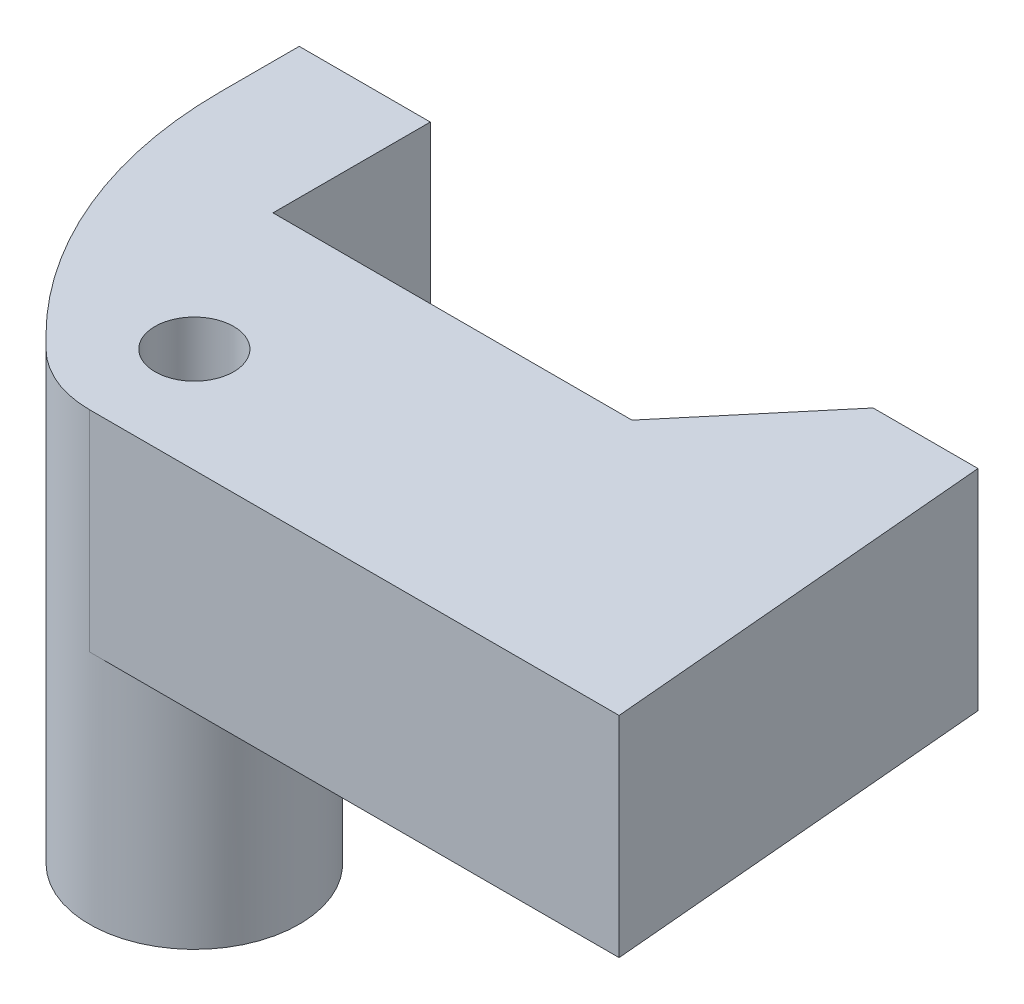
from build123d import *

# Parameters (mm, degrees)
SKETCH1_R           = 1.5
BOSS_EXTRUDE1_DEPTH = 8
BOSS_EXTRUDE2_START = 9
SKETCH2_R           = 1.5
BOSS_EXTRUDE2_DEPTH = 9


with BuildPart() as part:
    # Sketch1 → Boss-Extrude1 (new body)
    with BuildSketch(Plane(origin=(0, 0, 0), x_dir=(1, 0, 0), z_dir=(0, 1, 0))):
        with BuildLine():
            Line((-11, 13), (-11, 16))
            Line((-11, 16), (-6, 16))
            Line((-6, 16), (-6, 10))
            Line((-6, 10), (7.692171891, 10))
            Line((7.692171891, 10), (11.887670047, 15))
            Line((11.887670047, 15), (15.887670047, 15))
            Line((15.887670047, 15), (17.2, 0))
            Line((17.2, 0), (-3, 0))
            ThreePointArc((-3, 0), (-4.530733729, 0.30448187), (-5.828427125, 1.171572875))
            Line((-5.828427125, 1.171572875), (-6.292893219, 1.636038969))
            ThreePointArc((-6.292893219, 1.636038969), (-9.776662805, 6.849868608), (-11, 13))
        make_face()
        with Locations((-3, 4)):
            Circle(SKETCH1_R, mode=Mode.SUBTRACT)
    extrude(amount=BOSS_EXTRUDE1_DEPTH)

    # Sketch2 → Boss-Extrude2 (add)
    with BuildSketch(Plane.XZ.offset(BOSS_EXTRUDE2_START)):
        with BuildLine():
            Line((-5.828427125, -1.171572875), (-6.292893219, -1.636038969))
            ThreePointArc((-6.292893219, -1.636038969), (-9.776662805, -6.849868608), (-11, -13))
            Line((-11, -13), (-11, -16))
            Line((-11, -16), (-6, -16))
            Line((-6, -16), (-6, -8))
            Line((-6, -8), (-3, -8))
            ThreePointArc((-3, -8), (1, -4), (-3, 0))
            ThreePointArc((-3, 0), (-4.530733729, -0.30448187), (-5.828427125, -1.171572875))
        make_face()
        with Locations((-3, -4)):
            Circle(SKETCH2_R, mode=Mode.SUBTRACT)
    extrude(amount=-BOSS_EXTRUDE2_DEPTH)


solid = part.part
